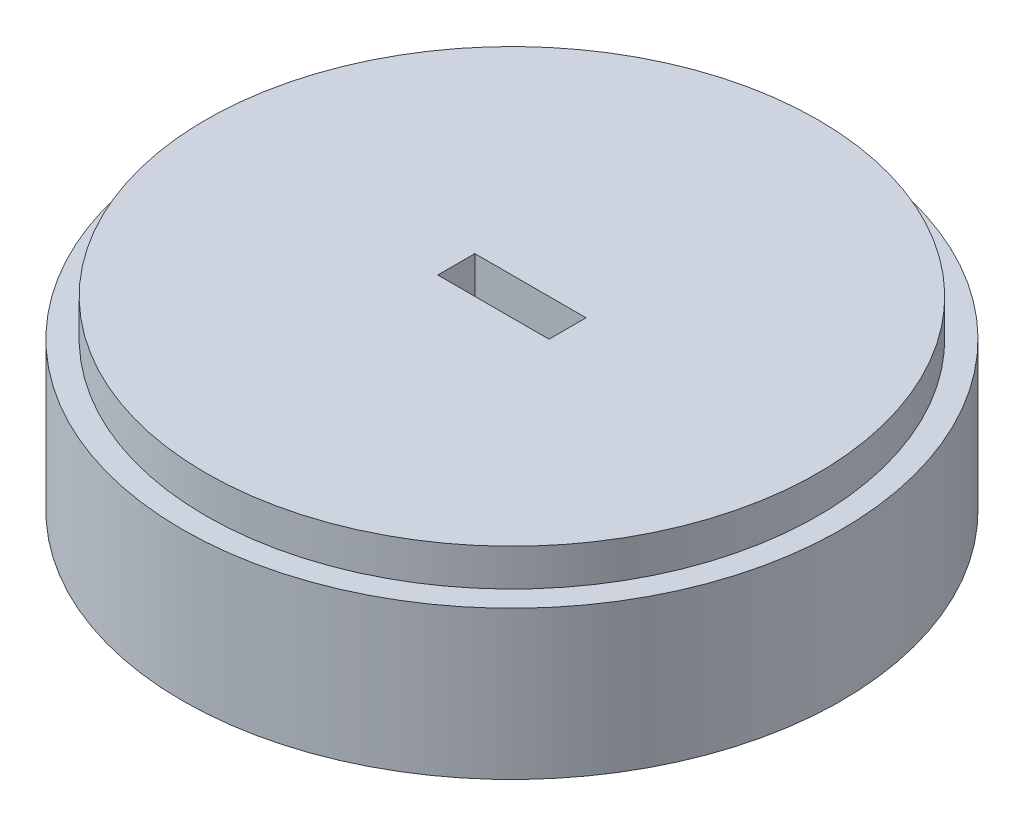
from build123d import *

# Parameters (mm, degrees)
SKETCH1_R           = 88.9
BOSS_EXTRUDE1_DEPTH = 40
SKETCH2_R           = 82.55
BOSS_EXTRUDE2_DEPTH = 10
SKETCH3_W           = 30
SKETCH3_H           = 35
CUT_EXTRUDE1_DEPTH  = 5


with BuildPart() as part:
    # Sketch1 → Boss-Extrude1 (new body)
    with BuildSketch(Plane(origin=(0, 0, 0), x_dir=(1, 0, 0), z_dir=(0, 1, 0))):
        Circle(SKETCH1_R)
    extrude(amount=BOSS_EXTRUDE1_DEPTH)

    # Sketch2 → Boss-Extrude2 (add)
    with BuildSketch(Plane(origin=(0, 40, 0), x_dir=(1, 0, 0), z_dir=(0, 1, 0))):
        Circle(SKETCH2_R)
    extrude(amount=BOSS_EXTRUDE2_DEPTH)

    # Sketch3 → Cut-Extrude1 (cut, symmetric)
    with BuildSketch(Plane.XY):
        with Locations((0, 32.5)):
            Rectangle(SKETCH3_W, SKETCH3_H)
    extrude(amount=CUT_EXTRUDE1_DEPTH, both=True, mode=Mode.SUBTRACT)


solid = part.part
